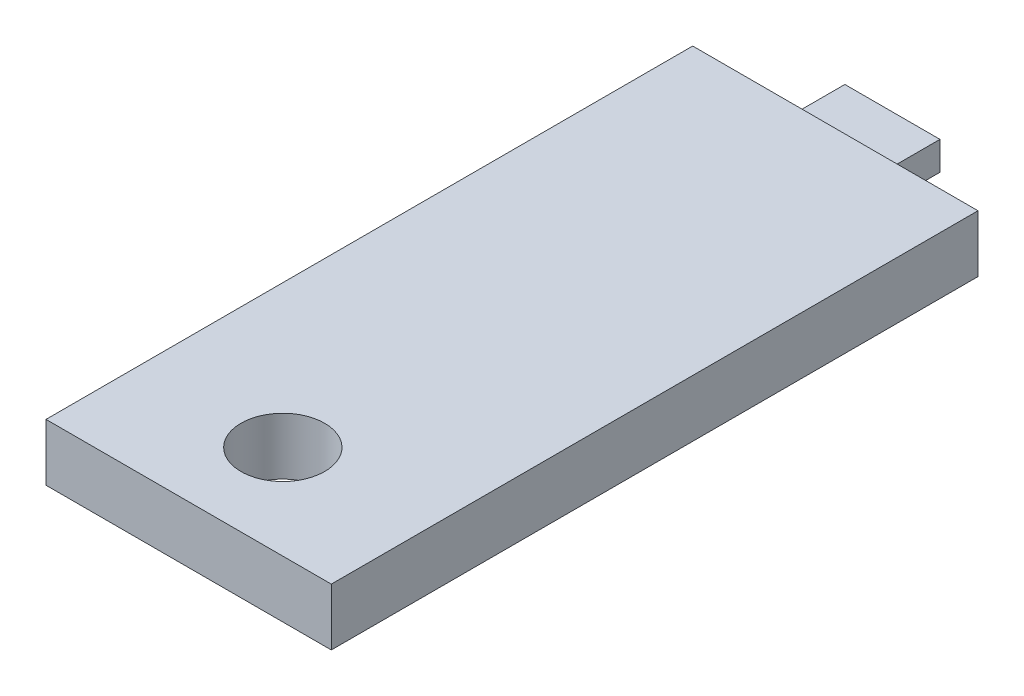
from build123d import *

# Parameters (mm, degrees)
SKETCH1_W           = 5
SKETCH1_H           = 1.5
BOSS_EXTRUDE1_DEPTH = 3
SKETCH2_W           = 15
SKETCH2_H           = 3
BOSS_EXTRUDE2_DEPTH = 34
SKETCH3_R           = 2.2
CUT_EXTRUDE1_DEPTH  = 39.444765573


with BuildPart() as part:
    # Sketch1 → Boss-Extrude1 (new body)
    with BuildSketch(Plane.XY):
        with Locations((2.5, 0.75)):
            Rectangle(SKETCH1_W, SKETCH1_H)
    extrude(amount=BOSS_EXTRUDE1_DEPTH)

    # Sketch2 → Boss-Extrude2 (add)
    with BuildSketch(Plane.XY.offset(3)):
        with Locations((2.5, 0.75)):
            Rectangle(SKETCH2_W, SKETCH2_H)
    extrude(amount=BOSS_EXTRUDE2_DEPTH)

    # Sketch3 → Cut-Extrude1 (cut, through all)
    with BuildSketch(Plane.XZ.offset(0.75)):
        with Locations((2.5, 32.049883395)):
            Circle(SKETCH3_R)
    extrude(amount=-CUT_EXTRUDE1_DEPTH, mode=Mode.SUBTRACT)


solid = part.part
